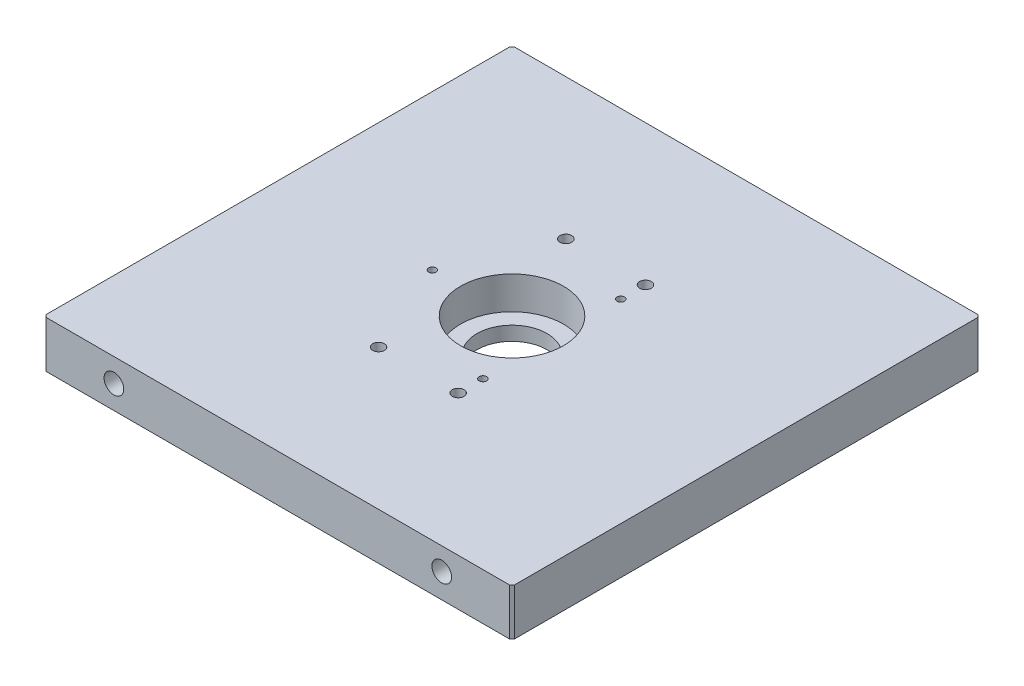
from build123d import *

# Parameters (mm, degrees)
BOSS_EXTRUDE1_DEPTH                  = 5
BOSS_EXTRUDE1_DEPTH_BACK             = 5
SKETCH1_W                            = 100
SKETCH1_H                            = 100
SKETCH1_R                            = 7.5
SKETCH2_R                            = 11
CUT_EXTRUDE1_DEPTH                   = 7
TAP_DRILL_FOR_M5X0_8_TAP1_AT_2_COUNT = 2
TAP_DRILL_FOR_M5X0_8_TAP1_AT_2_PITCH = 70.000402901
TAP_DRILL_FOR_M3X0_5_TAP2_D          = 2.5
TAP_DRILL_FOR_M3X0_5_TAP2_DEPTH      = 6
TAP_DRILL_FOR_M3X0_5_TAP2_TIP        = 0.751075774
CHAMFER1_SIZE                        = 0.5
M2X0_4_TAPPED_HOLE1_D                = 1.6
M2X0_4_TAPPED_HOLE1_DEPTH            = 3
M2X0_4_TAPPED_HOLE1_TIP              = 0.480688495


with BuildPart() as part:
    # Sketch1 → Boss-Extrude1 (new, two sides: drawn at the far end of the back side and taken through both)
    with BuildSketch(Plane(origin=(0, 0, 0), x_dir=(1, 0, 0), z_dir=(0, 1, 0)).offset(-BOSS_EXTRUDE1_DEPTH_BACK)):
        Rectangle(SKETCH1_W, SKETCH1_H)
        Circle(SKETCH1_R, mode=Mode.SUBTRACT)
    extrude(amount=BOSS_EXTRUDE1_DEPTH + BOSS_EXTRUDE1_DEPTH_BACK)

    # Sketch2 → Cut-Extrude1 (cut)
    with BuildSketch(Plane(origin=(0, 5, 0), x_dir=(1, 0, 0), z_dir=(0, 1, 0))):
        Circle(SKETCH2_R)
    extrude(amount=-CUT_EXTRUDE1_DEPTH, mode=Mode.SUBTRACT)

    # Sketch6 → Tap Drill for M5x0.8 Tap1 (revolve, cut)
    with BuildSketch(Plane(origin=(-35, 0, 50), x_dir=(0, -1, 0), z_dir=(1, 0, 0))):
        Polygon((0, 0), (0, 11.2618073), (2.1, 10), (2.1, 0), align=None)
    tap_drill_for_m5x0_8_tap1 = revolve(axis=Axis((-35, 0, 56.35), (0, 0, -1)), mode=Mode.SUBTRACT)

    # Tap Drill for M5x0.8 Tap1 at 2: Tap Drill for M5x0.8 Tap1 ×2
    with Locations(*[Vector(0.9999942443098965, 0.0033928376146228614, 0) * (i * TAP_DRILL_FOR_M5X0_8_TAP1_AT_2_PITCH) for i in range(1, TAP_DRILL_FOR_M5X0_8_TAP1_AT_2_COUNT)]):
        add(tap_drill_for_m5x0_8_tap1, mode=Mode.SUBTRACT)

    # Mirror1: Tap Drill for M5x0.8 Tap1 across plane
    add(tap_drill_for_m5x0_8_tap1.mirror(Plane(origin=(0, 0, 0), x_dir=(1, 0, 0), z_dir=(0, 0, -1))), mode=Mode.SUBTRACT)

    # Mirror1 copy 1 sketch → Mirror1 copy 1 (revolve, cut)
    with BuildSketch(Plane(origin=(35, 0.2375, -50), x_dir=(0, -1, 0), z_dir=(1, 0, 0))):
        Polygon((0, 0), (0, -11.2618073), (2.1, -10), (2.1, 0), align=None)
    revolve(axis=Axis((35, 0.2375, -56.35), (0, 0, -1)), mode=Mode.SUBTRACT)

    # Tap Drill for M3x0.5 Tap2
    with Locations(Plane(origin=(0, 5, 0), x_dir=(1, 0, 0), z_dir=(0, 1, 0))):
        with Locations((-8.5, -20), (8.5, -20), (8.5, 20), (-8.5, 20)):
            Hole(TAP_DRILL_FOR_M3X0_5_TAP2_D / 2, depth=TAP_DRILL_FOR_M3X0_5_TAP2_DEPTH)
            with Locations((0, 0, -(TAP_DRILL_FOR_M3X0_5_TAP2_DEPTH + TAP_DRILL_FOR_M3X0_5_TAP2_TIP / 2))):  # 118° drill point
                Cone(0, TAP_DRILL_FOR_M3X0_5_TAP2_D / 2, TAP_DRILL_FOR_M3X0_5_TAP2_TIP, mode=Mode.SUBTRACT)

    # Chamfer1
    chamfer1_edges = [part.edges().sort_by_distance(p)[0] for p in [
        (-50, 0, -50),
        (-50, 0, 50),
        (50, 0, 50),
        (50, 0, -50),
    ]]
    chamfer(chamfer1_edges, length=CHAMFER1_SIZE)

    # M2x0.4 Tapped Hole1
    with Locations(Plane(origin=(0, 5, 0), x_dir=(1, 0, 0), z_dir=(0, 1, 0))):
        with Locations((-17, 0), (8.500000003, -14.722431863), (8.500000003, 14.722431863)):
            Hole(M2X0_4_TAPPED_HOLE1_D / 2, depth=M2X0_4_TAPPED_HOLE1_DEPTH)
            with Locations((0, 0, -(M2X0_4_TAPPED_HOLE1_DEPTH + M2X0_4_TAPPED_HOLE1_TIP / 2))):  # 118° drill point
                Cone(0, M2X0_4_TAPPED_HOLE1_D / 2, M2X0_4_TAPPED_HOLE1_TIP, mode=Mode.SUBTRACT)


solid = part.part
